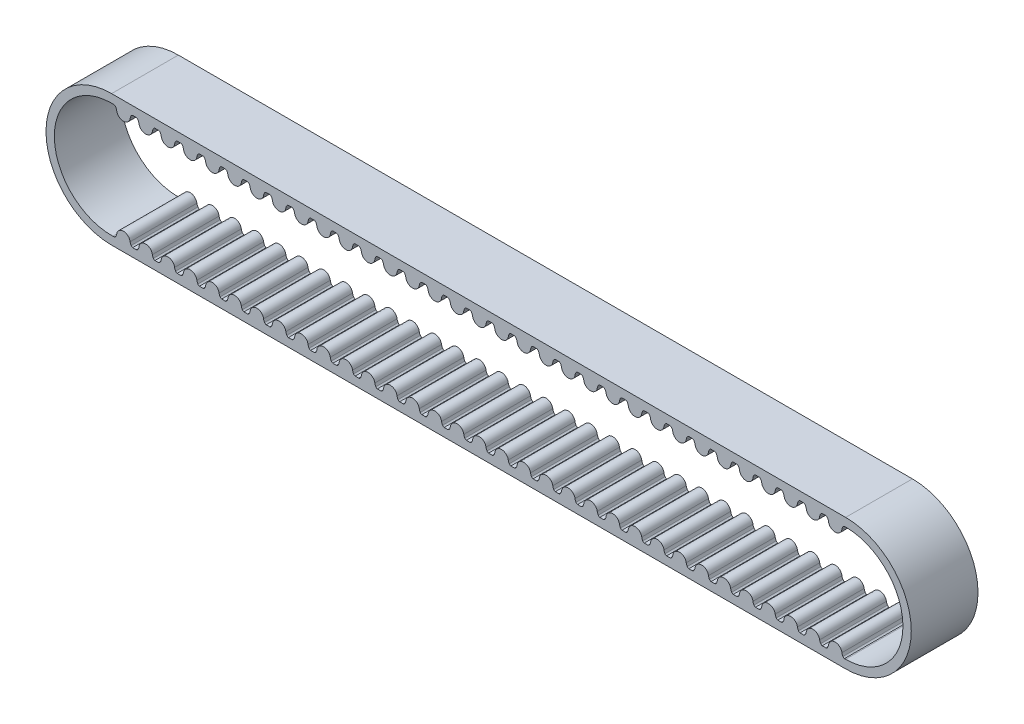
from build123d import *

# Parameters (mm, degrees)
BOSS_EXTRUDE1_DEPTH = 6


with BuildPart() as part:
    # Sketch1 → Boss-Extrude1 (new body)
    with BuildSketch(Plane.XY):
        with BuildLine():
            Line((-149.09186475, 9.090711875), (-83.09186475, 9.090711875))
            ThreePointArc((-83.09186475, 9.090711875), (-77.19186475, 3.190711875), (-83.09186475, -2.709288125))
            Line((-83.09186475, -2.709288125), (-149.09186475, -2.709288125))
            ThreePointArc((-149.09186475, -2.709288125), (-154.99186475, 3.190711875), (-149.09186475, 9.090711875))
        make_face()
        with BuildLine():
            Line((-148.86218671, -1.959304919), (-148.987691743, -1.959304919))
            ThreePointArc((-148.987691743, -1.959304919), (-154.24186475, 3.085711875), (-149.19686475, 8.340711875))
            Line((-149.19686475, 8.340711875), (-148.86218671, 8.34072867))
            ThreePointArc((-148.86218671, 8.34072867), (-148.782434101, 8.302805538), (-148.722766674, 8.237809494))
            ThreePointArc((-148.722766674, 8.237809494), (-148.665742437, 8.11963083), (-148.633605814, 7.992409772))
            ThreePointArc((-148.633605814, 7.992409772), (-148.030521792, 7.471711105), (-147.427440071, 7.992412438))
            ThreePointArc((-147.427440071, 7.992412438), (-147.395304056, 8.119633592), (-147.338280406, 8.237812478))
            ThreePointArc((-147.338280406, 8.237812478), (-147.278614273, 8.302808129), (-147.198941265, 8.340711875))
            Line((-147.198941265, 8.340711875), (-146.862186774, 8.34072867))
            ThreePointArc((-146.862186774, 8.34072867), (-146.782434165, 8.302805538), (-146.722766738, 8.237809494))
            ThreePointArc((-146.722766738, 8.237809494), (-146.665742501, 8.11963083), (-146.633605878, 7.992409772))
            ThreePointArc((-146.633605878, 7.992409772), (-146.030521856, 7.471711105), (-145.427440135, 7.992412438))
            ThreePointArc((-145.427440135, 7.992412438), (-145.395304121, 8.119633592), (-145.33828047, 8.237812478))
            ThreePointArc((-145.33828047, 8.237812478), (-145.278614337, 8.302808129), (-145.198941329, 8.340711875))
            Line((-145.198941329, 8.340711875), (-144.862186838, 8.34072867))
            ThreePointArc((-144.862186838, 8.34072867), (-144.78243423, 8.302805538), (-144.722766802, 8.237809494))
            ThreePointArc((-144.722766802, 8.237809494), (-144.665742565, 8.11963083), (-144.633605942, 7.992409772))
            ThreePointArc((-144.633605942, 7.992409772), (-144.03052192, 7.471711105), (-143.427440199, 7.992412438))
            ThreePointArc((-143.427440199, 7.992412438), (-143.395304185, 8.119633592), (-143.338280535, 8.237812478))
            ThreePointArc((-143.338280535, 8.237812478), (-143.278614401, 8.302808129), (-143.198941393, 8.340711875))
            Line((-143.198941393, 8.340711875), (-142.862186903, 8.34072867))
            ThreePointArc((-142.862186903, 8.34072867), (-142.782434294, 8.302805538), (-142.722766866, 8.237809494))
            ThreePointArc((-142.722766866, 8.237809494), (-142.665742629, 8.11963083), (-142.633606007, 7.992409772))
            ThreePointArc((-142.633606007, 7.992409772), (-142.030521984, 7.471711105), (-141.427440263, 7.992412438))
            ThreePointArc((-141.427440263, 7.992412438), (-141.395304249, 8.119633592), (-141.338280599, 8.237812478))
            ThreePointArc((-141.338280599, 8.237812478), (-141.278614465, 8.302808129), (-141.198941458, 8.340711875))
            Line((-141.198941458, 8.340711875), (-140.862186967, 8.34072867))
            ThreePointArc((-140.862186967, 8.34072867), (-140.782434358, 8.302805538), (-140.722766931, 8.237809494))
            ThreePointArc((-140.722766931, 8.237809494), (-140.665742694, 8.11963083), (-140.633606071, 7.992409772))
            ThreePointArc((-140.633606071, 7.992409772), (-140.030522048, 7.471711105), (-139.427440328, 7.992412438))
            ThreePointArc((-139.427440328, 7.992412438), (-139.395304313, 8.119633592), (-139.338280663, 8.237812478))
            ThreePointArc((-139.338280663, 8.237812478), (-139.27861453, 8.302808129), (-139.198941522, 8.340711875))
            Line((-139.198941522, 8.340711875), (-138.862187031, 8.34072867))
            ThreePointArc((-138.862187031, 8.34072867), (-138.782434422, 8.302805538), (-138.722766995, 8.237809494))
            ThreePointArc((-138.722766995, 8.237809494), (-138.665742758, 8.11963083), (-138.633606135, 7.992409772))
            ThreePointArc((-138.633606135, 7.992409772), (-138.030522113, 7.471711105), (-137.427440392, 7.992412438))
            ThreePointArc((-137.427440392, 7.992412438), (-137.395304377, 8.119633592), (-137.338280727, 8.237812478))
            ThreePointArc((-137.338280727, 8.237812478), (-137.278614594, 8.302808129), (-137.198941586, 8.340711875))
            Line((-137.198941586, 8.340711875), (-136.862187095, 8.34072867))
            ThreePointArc((-136.862187095, 8.34072867), (-136.782434486, 8.302805538), (-136.722767059, 8.237809494))
            ThreePointArc((-136.722767059, 8.237809494), (-136.665742822, 8.11963083), (-136.633606199, 7.992409772))
            ThreePointArc((-136.633606199, 7.992409772), (-136.030522177, 7.471711105), (-135.427440456, 7.992412438))
            ThreePointArc((-135.427440456, 7.992412438), (-135.395304442, 8.119633592), (-135.338280792, 8.237812478))
            ThreePointArc((-135.338280792, 8.237812478), (-135.278614658, 8.302808129), (-135.19894165, 8.340711875))
            Line((-135.19894165, 8.340711875), (-134.86218716, 8.34072867))
            ThreePointArc((-134.86218716, 8.34072867), (-134.782434551, 8.302805538), (-134.722767123, 8.237809494))
            ThreePointArc((-134.722767123, 8.237809494), (-134.665742886, 8.11963083), (-134.633606264, 7.992409772))
            ThreePointArc((-134.633606264, 7.992409772), (-134.030522241, 7.471711105), (-133.42744052, 7.992412438))
            ThreePointArc((-133.42744052, 7.992412438), (-133.395304506, 8.119633592), (-133.338280856, 8.237812478))
            ThreePointArc((-133.338280856, 8.237812478), (-133.278614722, 8.302808129), (-133.198941715, 8.340711875))
            Line((-133.198941715, 8.340711875), (-132.862187224, 8.34072867))
            ThreePointArc((-132.862187224, 8.34072867), (-132.782434615, 8.302805538), (-132.722767187, 8.237809494))
            ThreePointArc((-132.722767187, 8.237809494), (-132.665742951, 8.11963083), (-132.633606328, 7.992409772))
            ThreePointArc((-132.633606328, 7.992409772), (-132.030522305, 7.471711105), (-131.427440585, 7.992412438))
            ThreePointArc((-131.427440585, 7.992412438), (-131.39530457, 8.119633592), (-131.33828092, 8.237812478))
            ThreePointArc((-131.33828092, 8.237812478), (-131.278614786, 8.302808129), (-131.198941779, 8.340711875))
            Line((-131.198941779, 8.340711875), (-130.862187288, 8.34072867))
            ThreePointArc((-130.862187288, 8.34072867), (-130.782434679, 8.302805538), (-130.722767252, 8.237809494))
            ThreePointArc((-130.722767252, 8.237809494), (-130.665743015, 8.11963083), (-130.633606392, 7.992409772))
            ThreePointArc((-130.633606392, 7.992409772), (-130.03052237, 7.471711105), (-129.427440649, 7.992412438))
            ThreePointArc((-129.427440649, 7.992412438), (-129.395304634, 8.119633592), (-129.338280984, 8.237812478))
            ThreePointArc((-129.338280984, 8.237812478), (-129.278614851, 8.302808129), (-129.198941843, 8.340711875))
            Line((-129.198941843, 8.340711875), (-128.862187352, 8.34072867))
            ThreePointArc((-128.862187352, 8.34072867), (-128.782434743, 8.302805538), (-128.722767316, 8.237809494))
            ThreePointArc((-128.722767316, 8.237809494), (-128.665743079, 8.11963083), (-128.633606456, 7.992409772))
            ThreePointArc((-128.633606456, 7.992409772), (-128.030522434, 7.471711105), (-127.427440713, 7.992412438))
            ThreePointArc((-127.427440713, 7.992412438), (-127.395304699, 8.119633592), (-127.338281048, 8.237812478))
            ThreePointArc((-127.338281048, 8.237812478), (-127.278614915, 8.302808129), (-127.198941907, 8.340711875))
            Line((-127.198941907, 8.340711875), (-126.862187417, 8.34072867))
            ThreePointArc((-126.862187417, 8.34072867), (-126.782434808, 8.302805538), (-126.72276738, 8.237809494))
            ThreePointArc((-126.72276738, 8.237809494), (-126.665743143, 8.11963083), (-126.63360652, 7.992409772))
            ThreePointArc((-126.63360652, 7.992409772), (-126.030522498, 7.471711105), (-125.427440777, 7.992412438))
            ThreePointArc((-125.427440777, 7.992412438), (-125.395304763, 8.119633592), (-125.338281113, 8.237812478))
            ThreePointArc((-125.338281113, 8.237812478), (-125.278614979, 8.302808129), (-125.198941972, 8.340711875))
            Line((-125.198941972, 8.340711875), (-124.862187481, 8.34072867))
            ThreePointArc((-124.862187481, 8.34072867), (-124.782434872, 8.302805538), (-124.722767444, 8.237809494))
            ThreePointArc((-124.722767444, 8.237809494), (-124.665743208, 8.11963083), (-124.633606585, 7.992409772))
            ThreePointArc((-124.633606585, 7.992409772), (-124.030522562, 7.471711105), (-123.427440841, 7.992412438))
            ThreePointArc((-123.427440841, 7.992412438), (-123.395304827, 8.119633592), (-123.338281177, 8.237812478))
            ThreePointArc((-123.338281177, 8.237812478), (-123.278615043, 8.302808129), (-123.198942036, 8.340711875))
            Line((-123.198942036, 8.340711875), (-122.862187545, 8.34072867))
            ThreePointArc((-122.862187545, 8.34072867), (-122.782434936, 8.302805538), (-122.722767509, 8.237809494))
            ThreePointArc((-122.722767509, 8.237809494), (-122.665743272, 8.11963083), (-122.633606649, 7.992409772))
            ThreePointArc((-122.633606649, 7.992409772), (-122.030522627, 7.471711105), (-121.427440906, 7.992412438))
            ThreePointArc((-121.427440906, 7.992412438), (-121.395304891, 8.119633592), (-121.338281241, 8.237812478))
            ThreePointArc((-121.338281241, 8.237812478), (-121.278615108, 8.302808129), (-121.1989421, 8.340711875))
            Line((-121.1989421, 8.340711875), (-120.862187609, 8.34072867))
            ThreePointArc((-120.862187609, 8.34072867), (-120.782435, 8.302805538), (-120.722767573, 8.237809494))
            ThreePointArc((-120.722767573, 8.237809494), (-120.665743336, 8.11963083), (-120.633606713, 7.992409772))
            ThreePointArc((-120.633606713, 7.992409772), (-120.030522691, 7.471711105), (-119.42744097, 7.992412438))
            ThreePointArc((-119.42744097, 7.992412438), (-119.395304956, 8.119633592), (-119.338281305, 8.237812478))
            ThreePointArc((-119.338281305, 8.237812478), (-119.278615172, 8.302808129), (-119.198942164, 8.340711875))
            Line((-119.198942164, 8.340711875), (-118.862187673, 8.34072867))
            ThreePointArc((-118.862187673, 8.34072867), (-118.782435064, 8.302805538), (-118.722767637, 8.237809494))
            ThreePointArc((-118.722767637, 8.237809494), (-118.6657434, 8.11963083), (-118.633606777, 7.992409772))
            ThreePointArc((-118.633606777, 7.992409772), (-118.030522755, 7.471711105), (-117.427441034, 7.992412438))
            ThreePointArc((-117.427441034, 7.992412438), (-117.39530502, 8.119633592), (-117.33828137, 8.237812478))
            ThreePointArc((-117.33828137, 8.237812478), (-117.278615236, 8.302808129), (-117.198942228, 8.340711875))
            Line((-117.198942228, 8.340711875), (-116.862187738, 8.34072867))
            ThreePointArc((-116.862187738, 8.34072867), (-116.782435129, 8.302805538), (-116.722767701, 8.237809494))
            ThreePointArc((-116.722767701, 8.237809494), (-116.665743464, 8.11963083), (-116.633606842, 7.992409772))
            ThreePointArc((-116.633606842, 7.992409772), (-116.030522819, 7.471711105), (-115.427441098, 7.992412438))
            ThreePointArc((-115.427441098, 7.992412438), (-115.395305084, 8.119633592), (-115.338281434, 8.237812478))
            ThreePointArc((-115.338281434, 8.237812478), (-115.2786153, 8.302808129), (-115.198942293, 8.340711875))
            Line((-115.198942293, 8.340711875), (-114.862187802, 8.34072867))
            ThreePointArc((-114.862187802, 8.34072867), (-114.782435193, 8.302805538), (-114.722767766, 8.237809494))
            ThreePointArc((-114.722767766, 8.237809494), (-114.665743529, 8.11963083), (-114.633606906, 7.992409772))
            ThreePointArc((-114.633606906, 7.992409772), (-114.030522883, 7.471711105), (-113.427441163, 7.992412438))
            ThreePointArc((-113.427441163, 7.992412438), (-113.395305148, 8.119633592), (-113.338281498, 8.237812478))
            ThreePointArc((-113.338281498, 8.237812478), (-113.278615364, 8.302808129), (-113.198942357, 8.340711875))
            Line((-113.198942357, 8.340711875), (-112.862187866, 8.34072867))
            ThreePointArc((-112.862187866, 8.34072867), (-112.782435257, 8.302805538), (-112.72276783, 8.237809494))
            ThreePointArc((-112.72276783, 8.237809494), (-112.665743593, 8.11963083), (-112.63360697, 7.992409772))
            ThreePointArc((-112.63360697, 7.992409772), (-112.030522948, 7.471711105), (-111.427441227, 7.992412438))
            ThreePointArc((-111.427441227, 7.992412438), (-111.395305212, 8.119633592), (-111.338281562, 8.237812478))
            ThreePointArc((-111.338281562, 8.237812478), (-111.278615429, 8.302808129), (-111.198942421, 8.340711875))
            Line((-111.198942421, 8.340711875), (-110.86218793, 8.34072867))
            ThreePointArc((-110.86218793, 8.34072867), (-110.782435321, 8.302805538), (-110.722767894, 8.237809494))
            ThreePointArc((-110.722767894, 8.237809494), (-110.665743657, 8.11963083), (-110.633607034, 7.992409772))
            ThreePointArc((-110.633607034, 7.992409772), (-110.030523012, 7.471711105), (-109.427441291, 7.992412438))
            ThreePointArc((-109.427441291, 7.992412438), (-109.395305277, 8.119633592), (-109.338281627, 8.237812478))
            ThreePointArc((-109.338281627, 8.237812478), (-109.278615493, 8.302808129), (-109.198942485, 8.340711875))
            Line((-109.198942485, 8.340711875), (-108.862187995, 8.34072867))
            ThreePointArc((-108.862187995, 8.34072867), (-108.782435386, 8.302805538), (-108.722767958, 8.237809494))
            ThreePointArc((-108.722767958, 8.237809494), (-108.665743721, 8.11963083), (-108.633607098, 7.992409772))
            ThreePointArc((-108.633607098, 7.992409772), (-108.030523076, 7.471711105), (-107.427441355, 7.992412438))
            ThreePointArc((-107.427441355, 7.992412438), (-107.395305341, 8.119633592), (-107.338281691, 8.237812478))
            ThreePointArc((-107.338281691, 8.237812478), (-107.278615557, 8.302808129), (-107.19894255, 8.340711875))
            Line((-107.19894255, 8.340711875), (-106.862188059, 8.34072867))
            ThreePointArc((-106.862188059, 8.34072867), (-106.78243545, 8.302805538), (-106.722768022, 8.237809494))
            ThreePointArc((-106.722768022, 8.237809494), (-106.665743786, 8.11963083), (-106.633607163, 7.992409772))
            ThreePointArc((-106.633607163, 7.992409772), (-106.03052314, 7.471711105), (-105.42744142, 7.992412438))
            ThreePointArc((-105.42744142, 7.992412438), (-105.395305405, 8.119633592), (-105.338281755, 8.237812478))
            ThreePointArc((-105.338281755, 8.237812478), (-105.278615621, 8.302808129), (-105.198942614, 8.340711875))
            Line((-105.198942614, 8.340711875), (-104.862188123, 8.34072867))
            ThreePointArc((-104.862188123, 8.34072867), (-104.782435514, 8.302805538), (-104.722768087, 8.237809494))
            ThreePointArc((-104.722768087, 8.237809494), (-104.66574385, 8.11963083), (-104.633607227, 7.992409772))
            ThreePointArc((-104.633607227, 7.992409772), (-104.030523205, 7.471711105), (-103.427441484, 7.992412438))
            ThreePointArc((-103.427441484, 7.992412438), (-103.395305469, 8.119633592), (-103.338281819, 8.237812478))
            ThreePointArc((-103.338281819, 8.237812478), (-103.278615686, 8.302808129), (-103.198942678, 8.340711875))
            Line((-103.198942678, 8.340711875), (-102.862188187, 8.34072867))
            ThreePointArc((-102.862188187, 8.34072867), (-102.782435578, 8.302805538), (-102.722768151, 8.237809494))
            ThreePointArc((-102.722768151, 8.237809494), (-102.665743914, 8.11963083), (-102.633607291, 7.992409772))
            ThreePointArc((-102.633607291, 7.992409772), (-102.030523269, 7.471711105), (-101.427441548, 7.992412438))
            ThreePointArc((-101.427441548, 7.992412438), (-101.395305534, 8.119633592), (-101.338281883, 8.237812478))
            ThreePointArc((-101.338281883, 8.237812478), (-101.27861575, 8.302808129), (-101.198942742, 8.340711875))
            Line((-101.198942742, 8.340711875), (-100.862188251, 8.34072867))
            ThreePointArc((-100.862188251, 8.34072867), (-100.782435643, 8.302805538), (-100.722768215, 8.237809494))
            ThreePointArc((-100.722768215, 8.237809494), (-100.665743978, 8.11963083), (-100.633607355, 7.992409772))
            ThreePointArc((-100.633607355, 7.992409772), (-100.030523333, 7.471711105), (-99.427441612, 7.992412438))
            ThreePointArc((-99.427441612, 7.992412438), (-99.395305598, 8.119633592), (-99.338281948, 8.237812478))
            ThreePointArc((-99.338281948, 8.237812478), (-99.278615814, 8.302808129), (-99.198942806, 8.340711875))
            Line((-99.198942806, 8.340711875), (-98.862188316, 8.34072867))
            ThreePointArc((-98.862188316, 8.34072867), (-98.782435707, 8.302805538), (-98.722768279, 8.237809494))
            ThreePointArc((-98.722768279, 8.237809494), (-98.665744042, 8.11963083), (-98.63360742, 7.992409772))
            ThreePointArc((-98.63360742, 7.992409772), (-98.030523397, 7.471711105), (-97.427441676, 7.992412438))
            ThreePointArc((-97.427441676, 7.992412438), (-97.395305662, 8.119633592), (-97.338282012, 8.237812478))
            ThreePointArc((-97.338282012, 8.237812478), (-97.278615878, 8.302808129), (-97.198942871, 8.340711875))
            Line((-97.198942871, 8.340711875), (-96.86218838, 8.34072867))
            ThreePointArc((-96.86218838, 8.34072867), (-96.782435771, 8.302805538), (-96.722768344, 8.237809494))
            ThreePointArc((-96.722768344, 8.237809494), (-96.665744107, 8.11963083), (-96.633607484, 7.992409772))
            ThreePointArc((-96.633607484, 7.992409772), (-96.030523461, 7.471711105), (-95.427441741, 7.992412438))
            ThreePointArc((-95.427441741, 7.992412438), (-95.395305726, 8.119633592), (-95.338282076, 8.237812478))
            ThreePointArc((-95.338282076, 8.237812478), (-95.278615943, 8.302808129), (-95.198942935, 8.340711875))
            Line((-95.198942935, 8.340711875), (-94.862188444, 8.34072867))
            ThreePointArc((-94.862188444, 8.34072867), (-94.782435835, 8.302805538), (-94.722768408, 8.237809494))
            ThreePointArc((-94.722768408, 8.237809494), (-94.665744171, 8.11963083), (-94.633607548, 7.992409772))
            ThreePointArc((-94.633607548, 7.992409772), (-94.030523526, 7.471711105), (-93.427441805, 7.992412438))
            ThreePointArc((-93.427441805, 7.992412438), (-93.39530579, 8.119633592), (-93.33828214, 8.237812478))
            ThreePointArc((-93.33828214, 8.237812478), (-93.278616007, 8.302808129), (-93.198942999, 8.340711875))
            Line((-93.198942999, 8.340711875), (-92.862188508, 8.34072867))
            ThreePointArc((-92.862188508, 8.34072867), (-92.782435899, 8.302805538), (-92.722768472, 8.237809494))
            ThreePointArc((-92.722768472, 8.237809494), (-92.665744235, 8.11963083), (-92.633607612, 7.992409772))
            ThreePointArc((-92.633607612, 7.992409772), (-92.03052359, 7.471711105), (-91.427441869, 7.992412438))
            ThreePointArc((-91.427441869, 7.992412438), (-91.395305855, 8.119633592), (-91.338282205, 8.237812478))
            ThreePointArc((-91.338282205, 8.237812478), (-91.278616071, 8.302808129), (-91.198943063, 8.340711875))
            Line((-91.198943063, 8.340711875), (-90.862188573, 8.34072867))
            ThreePointArc((-90.862188573, 8.34072867), (-90.782435964, 8.302805538), (-90.722768536, 8.237809494))
            ThreePointArc((-90.722768536, 8.237809494), (-90.665744299, 8.11963083), (-90.633607677, 7.992409772))
            ThreePointArc((-90.633607677, 7.992409772), (-90.030523654, 7.471711105), (-89.427441933, 7.992412438))
            ThreePointArc((-89.427441933, 7.992412438), (-89.395305919, 8.119633592), (-89.338282269, 8.237812478))
            ThreePointArc((-89.338282269, 8.237812478), (-89.278616135, 8.302808129), (-89.198943128, 8.340711875))
            Line((-89.198943128, 8.340711875), (-88.862188637, 8.34072867))
            ThreePointArc((-88.862188637, 8.34072867), (-88.782436028, 8.302805538), (-88.7227686, 8.237809494))
            ThreePointArc((-88.7227686, 8.237809494), (-88.665744364, 8.11963083), (-88.633607741, 7.992409772))
            ThreePointArc((-88.633607741, 7.992409772), (-88.030523718, 7.471711105), (-87.427441998, 7.992412438))
            ThreePointArc((-87.427441998, 7.992412438), (-87.395305983, 8.119633592), (-87.338282333, 8.237812478))
            ThreePointArc((-87.338282333, 8.237812478), (-87.278616199, 8.302808129), (-87.198943192, 8.340711875))
            Line((-87.198943192, 8.340711875), (-86.862188701, 8.34072867))
            ThreePointArc((-86.862188701, 8.34072867), (-86.782436092, 8.302805538), (-86.722768665, 8.237809494))
            ThreePointArc((-86.722768665, 8.237809494), (-86.665744428, 8.11963083), (-86.633607805, 7.992409772))
            ThreePointArc((-86.633607805, 7.992409772), (-86.030523783, 7.471711105), (-85.427442062, 7.992412438))
            ThreePointArc((-85.427442062, 7.992412438), (-85.395306047, 8.119633592), (-85.338282397, 8.237812478))
            ThreePointArc((-85.338282397, 8.237812478), (-85.278616264, 8.302808129), (-85.198943256, 8.340711875))
            Line((-85.198943256, 8.340711875), (-84.862188765, 8.34072867))
            ThreePointArc((-84.862188765, 8.34072867), (-84.782436156, 8.302805538), (-84.722768729, 8.237809494))
            ThreePointArc((-84.722768729, 8.237809494), (-84.665744492, 8.11963083), (-84.633607869, 7.992409772))
            ThreePointArc((-84.633607869, 7.992409772), (-84.030523847, 7.471711105), (-83.427442126, 7.992412438))
            ThreePointArc((-83.427442126, 7.992412438), (-83.395306112, 8.119633592), (-83.338282461, 8.237812478))
            ThreePointArc((-83.338282461, 8.237812478), (-83.278616328, 8.302808129), (-83.19894332, 8.340711875))
            Line((-83.19894332, 8.340711875), (-83.09186475, 8.340711875))
            ThreePointArc((-83.09186475, 8.340711875), (-77.94186475, 3.190711875), (-83.09186475, -1.959288125))
            Line((-83.09186475, -1.959288125), (-83.19894332, -1.959288125))
            ThreePointArc((-83.19894332, -1.959288125), (-83.278616328, -1.921384378), (-83.338282461, -1.856388727))
            ThreePointArc((-83.338282461, -1.856388727), (-83.395306112, -1.738209842), (-83.427442126, -1.610988687))
            ThreePointArc((-83.427442126, -1.610988687), (-84.030523847, -1.090287354), (-84.633607869, -1.610986021))
            ThreePointArc((-84.633607869, -1.610986021), (-84.665744492, -1.73820708), (-84.722768729, -1.856385743))
            ThreePointArc((-84.722768729, -1.856385743), (-84.782436156, -1.921381787), (-84.862188765, -1.959304919))
            Line((-84.862188765, -1.959304919), (-85.198943256, -1.959288125))
            ThreePointArc((-85.198943256, -1.959288125), (-85.278616264, -1.921384378), (-85.338282397, -1.856388727))
            ThreePointArc((-85.338282397, -1.856388727), (-85.395306047, -1.738209842), (-85.427442062, -1.610988687))
            ThreePointArc((-85.427442062, -1.610988687), (-86.030523783, -1.090287354), (-86.633607805, -1.610986021))
            ThreePointArc((-86.633607805, -1.610986021), (-86.665744428, -1.73820708), (-86.722768665, -1.856385743))
            ThreePointArc((-86.722768665, -1.856385743), (-86.782436092, -1.921381787), (-86.862188701, -1.959304919))
            Line((-86.862188701, -1.959304919), (-87.198943192, -1.959288125))
            ThreePointArc((-87.198943192, -1.959288125), (-87.278616199, -1.921384378), (-87.338282333, -1.856388727))
            ThreePointArc((-87.338282333, -1.856388727), (-87.395305983, -1.738209842), (-87.427441998, -1.610988687))
            ThreePointArc((-87.427441998, -1.610988687), (-88.030523718, -1.090287354), (-88.633607741, -1.610986021))
            ThreePointArc((-88.633607741, -1.610986021), (-88.665744364, -1.73820708), (-88.7227686, -1.856385743))
            ThreePointArc((-88.7227686, -1.856385743), (-88.782436028, -1.921381787), (-88.862188637, -1.959304919))
            Line((-88.862188637, -1.959304919), (-89.198943128, -1.959288125))
            ThreePointArc((-89.198943128, -1.959288125), (-89.278616135, -1.921384378), (-89.338282269, -1.856388727))
            ThreePointArc((-89.338282269, -1.856388727), (-89.395305919, -1.738209842), (-89.427441933, -1.610988687))
            ThreePointArc((-89.427441933, -1.610988687), (-90.030523654, -1.090287354), (-90.633607677, -1.610986021))
            ThreePointArc((-90.633607677, -1.610986021), (-90.665744299, -1.73820708), (-90.722768536, -1.856385743))
            ThreePointArc((-90.722768536, -1.856385743), (-90.782435964, -1.921381787), (-90.862188573, -1.959304919))
            Line((-90.862188573, -1.959304919), (-91.198943063, -1.959288125))
            ThreePointArc((-91.198943063, -1.959288125), (-91.278616071, -1.921384378), (-91.338282205, -1.856388727))
            ThreePointArc((-91.338282205, -1.856388727), (-91.395305855, -1.738209842), (-91.427441869, -1.610988687))
            ThreePointArc((-91.427441869, -1.610988687), (-92.03052359, -1.090287354), (-92.633607612, -1.610986021))
            ThreePointArc((-92.633607612, -1.610986021), (-92.665744235, -1.73820708), (-92.722768472, -1.856385743))
            ThreePointArc((-92.722768472, -1.856385743), (-92.782435899, -1.921381787), (-92.862188508, -1.959304919))
            Line((-92.862188508, -1.959304919), (-93.198942999, -1.959288125))
            ThreePointArc((-93.198942999, -1.959288125), (-93.278616007, -1.921384378), (-93.33828214, -1.856388727))
            ThreePointArc((-93.33828214, -1.856388727), (-93.39530579, -1.738209842), (-93.427441805, -1.610988687))
            ThreePointArc((-93.427441805, -1.610988687), (-94.030523526, -1.090287354), (-94.633607548, -1.610986021))
            ThreePointArc((-94.633607548, -1.610986021), (-94.665744171, -1.73820708), (-94.722768408, -1.856385743))
            ThreePointArc((-94.722768408, -1.856385743), (-94.782435835, -1.921381787), (-94.862188444, -1.959304919))
            Line((-94.862188444, -1.959304919), (-95.198942935, -1.959288125))
            ThreePointArc((-95.198942935, -1.959288125), (-95.278615943, -1.921384378), (-95.338282076, -1.856388727))
            ThreePointArc((-95.338282076, -1.856388727), (-95.395305726, -1.738209842), (-95.427441741, -1.610988687))
            ThreePointArc((-95.427441741, -1.610988687), (-96.030523461, -1.090287354), (-96.633607484, -1.610986021))
            ThreePointArc((-96.633607484, -1.610986021), (-96.665744107, -1.73820708), (-96.722768344, -1.856385743))
            ThreePointArc((-96.722768344, -1.856385743), (-96.782435771, -1.921381787), (-96.86218838, -1.959304919))
            Line((-96.86218838, -1.959304919), (-97.198942871, -1.959288125))
            ThreePointArc((-97.198942871, -1.959288125), (-97.278615878, -1.921384378), (-97.338282012, -1.856388727))
            ThreePointArc((-97.338282012, -1.856388727), (-97.395305662, -1.738209842), (-97.427441676, -1.610988687))
            ThreePointArc((-97.427441676, -1.610988687), (-98.030523397, -1.090287354), (-98.63360742, -1.610986021))
            ThreePointArc((-98.63360742, -1.610986021), (-98.665744042, -1.73820708), (-98.722768279, -1.856385743))
            ThreePointArc((-98.722768279, -1.856385743), (-98.782435707, -1.921381787), (-98.862188316, -1.959304919))
            Line((-98.862188316, -1.959304919), (-99.198942806, -1.959288125))
            ThreePointArc((-99.198942806, -1.959288125), (-99.278615814, -1.921384378), (-99.338281948, -1.856388727))
            ThreePointArc((-99.338281948, -1.856388727), (-99.395305598, -1.738209842), (-99.427441612, -1.610988687))
            ThreePointArc((-99.427441612, -1.610988687), (-100.030523333, -1.090287354), (-100.633607355, -1.610986021))
            ThreePointArc((-100.633607355, -1.610986021), (-100.665743978, -1.73820708), (-100.722768215, -1.856385743))
            ThreePointArc((-100.722768215, -1.856385743), (-100.782435643, -1.921381787), (-100.862188251, -1.959304919))
            Line((-100.862188251, -1.959304919), (-101.198942742, -1.959288125))
            ThreePointArc((-101.198942742, -1.959288125), (-101.27861575, -1.921384378), (-101.338281883, -1.856388727))
            ThreePointArc((-101.338281883, -1.856388727), (-101.395305534, -1.738209842), (-101.427441548, -1.610988687))
            ThreePointArc((-101.427441548, -1.610988687), (-102.030523269, -1.090287354), (-102.633607291, -1.610986021))
            ThreePointArc((-102.633607291, -1.610986021), (-102.665743914, -1.73820708), (-102.722768151, -1.856385743))
            ThreePointArc((-102.722768151, -1.856385743), (-102.782435578, -1.921381787), (-102.862188187, -1.959304919))
            Line((-102.862188187, -1.959304919), (-103.198942678, -1.959288125))
            ThreePointArc((-103.198942678, -1.959288125), (-103.278615686, -1.921384378), (-103.338281819, -1.856388727))
            ThreePointArc((-103.338281819, -1.856388727), (-103.395305469, -1.738209842), (-103.427441484, -1.610988687))
            ThreePointArc((-103.427441484, -1.610988687), (-104.030523205, -1.090287354), (-104.633607227, -1.610986021))
            ThreePointArc((-104.633607227, -1.610986021), (-104.66574385, -1.73820708), (-104.722768087, -1.856385743))
            ThreePointArc((-104.722768087, -1.856385743), (-104.782435514, -1.921381787), (-104.862188123, -1.959304919))
            Line((-104.862188123, -1.959304919), (-105.198942614, -1.959288125))
            ThreePointArc((-105.198942614, -1.959288125), (-105.278615621, -1.921384378), (-105.338281755, -1.856388727))
            ThreePointArc((-105.338281755, -1.856388727), (-105.395305405, -1.738209842), (-105.42744142, -1.610988687))
            ThreePointArc((-105.42744142, -1.610988687), (-106.03052314, -1.090287354), (-106.633607163, -1.610986021))
            ThreePointArc((-106.633607163, -1.610986021), (-106.665743786, -1.73820708), (-106.722768022, -1.856385743))
            ThreePointArc((-106.722768022, -1.856385743), (-106.78243545, -1.921381787), (-106.862188059, -1.959304919))
            Line((-106.862188059, -1.959304919), (-107.19894255, -1.959288125))
            ThreePointArc((-107.19894255, -1.959288125), (-107.278615557, -1.921384378), (-107.338281691, -1.856388727))
            ThreePointArc((-107.338281691, -1.856388727), (-107.395305341, -1.738209842), (-107.427441355, -1.610988687))
            ThreePointArc((-107.427441355, -1.610988687), (-108.030523076, -1.090287354), (-108.633607098, -1.610986021))
            ThreePointArc((-108.633607098, -1.610986021), (-108.665743721, -1.73820708), (-108.722767958, -1.856385743))
            ThreePointArc((-108.722767958, -1.856385743), (-108.782435386, -1.921381787), (-108.862187995, -1.959304919))
            Line((-108.862187995, -1.959304919), (-109.198942485, -1.959288125))
            ThreePointArc((-109.198942485, -1.959288125), (-109.278615493, -1.921384378), (-109.338281627, -1.856388727))
            ThreePointArc((-109.338281627, -1.856388727), (-109.395305277, -1.738209842), (-109.427441291, -1.610988687))
            ThreePointArc((-109.427441291, -1.610988687), (-110.030523012, -1.090287354), (-110.633607034, -1.610986021))
            ThreePointArc((-110.633607034, -1.610986021), (-110.665743657, -1.73820708), (-110.722767894, -1.856385743))
            ThreePointArc((-110.722767894, -1.856385743), (-110.782435321, -1.921381787), (-110.86218793, -1.959304919))
            Line((-110.86218793, -1.959304919), (-111.198942421, -1.959288125))
            ThreePointArc((-111.198942421, -1.959288125), (-111.278615429, -1.921384378), (-111.338281562, -1.856388727))
            ThreePointArc((-111.338281562, -1.856388727), (-111.395305212, -1.738209842), (-111.427441227, -1.610988687))
            ThreePointArc((-111.427441227, -1.610988687), (-112.030522948, -1.090287354), (-112.63360697, -1.610986021))
            ThreePointArc((-112.63360697, -1.610986021), (-112.665743593, -1.73820708), (-112.72276783, -1.856385743))
            ThreePointArc((-112.72276783, -1.856385743), (-112.782435257, -1.921381787), (-112.862187866, -1.959304919))
            Line((-112.862187866, -1.959304919), (-113.198942357, -1.959288125))
            ThreePointArc((-113.198942357, -1.959288125), (-113.278615364, -1.921384378), (-113.338281498, -1.856388727))
            ThreePointArc((-113.338281498, -1.856388727), (-113.395305148, -1.738209842), (-113.427441163, -1.610988687))
            ThreePointArc((-113.427441163, -1.610988687), (-114.030522883, -1.090287354), (-114.633606906, -1.610986021))
            ThreePointArc((-114.633606906, -1.610986021), (-114.665743529, -1.73820708), (-114.722767766, -1.856385743))
            ThreePointArc((-114.722767766, -1.856385743), (-114.782435193, -1.921381787), (-114.862187802, -1.959304919))
            Line((-114.862187802, -1.959304919), (-115.198942293, -1.959288125))
            ThreePointArc((-115.198942293, -1.959288125), (-115.2786153, -1.921384378), (-115.338281434, -1.856388727))
            ThreePointArc((-115.338281434, -1.856388727), (-115.395305084, -1.738209842), (-115.427441098, -1.610988687))
            ThreePointArc((-115.427441098, -1.610988687), (-116.030522819, -1.090287354), (-116.633606842, -1.610986021))
            ThreePointArc((-116.633606842, -1.610986021), (-116.665743464, -1.73820708), (-116.722767701, -1.856385743))
            ThreePointArc((-116.722767701, -1.856385743), (-116.782435129, -1.921381787), (-116.862187738, -1.959304919))
            Line((-116.862187738, -1.959304919), (-117.198942228, -1.959288125))
            ThreePointArc((-117.198942228, -1.959288125), (-117.278615236, -1.921384378), (-117.33828137, -1.856388727))
            ThreePointArc((-117.33828137, -1.856388727), (-117.39530502, -1.738209842), (-117.427441034, -1.610988687))
            ThreePointArc((-117.427441034, -1.610988687), (-118.030522755, -1.090287354), (-118.633606777, -1.610986021))
            ThreePointArc((-118.633606777, -1.610986021), (-118.6657434, -1.73820708), (-118.722767637, -1.856385743))
            ThreePointArc((-118.722767637, -1.856385743), (-118.782435064, -1.921381787), (-118.862187673, -1.959304919))
            Line((-118.862187673, -1.959304919), (-119.198942164, -1.959288125))
            ThreePointArc((-119.198942164, -1.959288125), (-119.278615172, -1.921384378), (-119.338281305, -1.856388727))
            ThreePointArc((-119.338281305, -1.856388727), (-119.395304956, -1.738209842), (-119.42744097, -1.610988687))
            ThreePointArc((-119.42744097, -1.610988687), (-120.030522691, -1.090287354), (-120.633606713, -1.610986021))
            ThreePointArc((-120.633606713, -1.610986021), (-120.665743336, -1.73820708), (-120.722767573, -1.856385743))
            ThreePointArc((-120.722767573, -1.856385743), (-120.782435, -1.921381787), (-120.862187609, -1.959304919))
            Line((-120.862187609, -1.959304919), (-121.1989421, -1.959288125))
            ThreePointArc((-121.1989421, -1.959288125), (-121.278615108, -1.921384378), (-121.338281241, -1.856388727))
            ThreePointArc((-121.338281241, -1.856388727), (-121.395304891, -1.738209842), (-121.427440906, -1.610988687))
            ThreePointArc((-121.427440906, -1.610988687), (-122.030522627, -1.090287354), (-122.633606649, -1.610986021))
            ThreePointArc((-122.633606649, -1.610986021), (-122.665743272, -1.73820708), (-122.722767509, -1.856385743))
            ThreePointArc((-122.722767509, -1.856385743), (-122.782434936, -1.921381787), (-122.862187545, -1.959304919))
            Line((-122.862187545, -1.959304919), (-123.198942036, -1.959288125))
            ThreePointArc((-123.198942036, -1.959288125), (-123.278615043, -1.921384378), (-123.338281177, -1.856388727))
            ThreePointArc((-123.338281177, -1.856388727), (-123.395304827, -1.738209842), (-123.427440841, -1.610988687))
            ThreePointArc((-123.427440841, -1.610988687), (-124.030522562, -1.090287354), (-124.633606585, -1.610986021))
            ThreePointArc((-124.633606585, -1.610986021), (-124.665743208, -1.73820708), (-124.722767444, -1.856385743))
            ThreePointArc((-124.722767444, -1.856385743), (-124.782434872, -1.921381787), (-124.862187481, -1.959304919))
            Line((-124.862187481, -1.959304919), (-125.198941972, -1.959288125))
            ThreePointArc((-125.198941972, -1.959288125), (-125.278614979, -1.921384378), (-125.338281113, -1.856388727))
            ThreePointArc((-125.338281113, -1.856388727), (-125.395304763, -1.738209842), (-125.427440777, -1.610988687))
            ThreePointArc((-125.427440777, -1.610988687), (-126.030522498, -1.090287354), (-126.63360652, -1.610986021))
            ThreePointArc((-126.63360652, -1.610986021), (-126.665743143, -1.73820708), (-126.72276738, -1.856385743))
            ThreePointArc((-126.72276738, -1.856385743), (-126.782434808, -1.921381787), (-126.862187417, -1.959304919))
            Line((-126.862187417, -1.959304919), (-127.198941907, -1.959288125))
            ThreePointArc((-127.198941907, -1.959288125), (-127.278614915, -1.921384378), (-127.338281048, -1.856388727))
            ThreePointArc((-127.338281048, -1.856388727), (-127.395304699, -1.738209842), (-127.427440713, -1.610988687))
            ThreePointArc((-127.427440713, -1.610988687), (-128.030522434, -1.090287354), (-128.633606456, -1.610986021))
            ThreePointArc((-128.633606456, -1.610986021), (-128.665743079, -1.73820708), (-128.722767316, -1.856385743))
            ThreePointArc((-128.722767316, -1.856385743), (-128.782434743, -1.921381787), (-128.862187352, -1.959304919))
            Line((-128.862187352, -1.959304919), (-129.198941843, -1.959288125))
            ThreePointArc((-129.198941843, -1.959288125), (-129.278614851, -1.921384378), (-129.338280984, -1.856388727))
            ThreePointArc((-129.338280984, -1.856388727), (-129.395304634, -1.738209842), (-129.427440649, -1.610988687))
            ThreePointArc((-129.427440649, -1.610988687), (-130.03052237, -1.090287354), (-130.633606392, -1.610986021))
            ThreePointArc((-130.633606392, -1.610986021), (-130.665743015, -1.73820708), (-130.722767252, -1.856385743))
            ThreePointArc((-130.722767252, -1.856385743), (-130.782434679, -1.921381787), (-130.862187288, -1.959304919))
            Line((-130.862187288, -1.959304919), (-131.198941779, -1.959288125))
            ThreePointArc((-131.198941779, -1.959288125), (-131.278614786, -1.921384378), (-131.33828092, -1.856388727))
            ThreePointArc((-131.33828092, -1.856388727), (-131.39530457, -1.738209842), (-131.427440585, -1.610988687))
            ThreePointArc((-131.427440585, -1.610988687), (-132.030522305, -1.090287354), (-132.633606328, -1.610986021))
            ThreePointArc((-132.633606328, -1.610986021), (-132.665742951, -1.73820708), (-132.722767187, -1.856385743))
            ThreePointArc((-132.722767187, -1.856385743), (-132.782434615, -1.921381787), (-132.862187224, -1.959304919))
            Line((-132.862187224, -1.959304919), (-133.198941715, -1.959288125))
            ThreePointArc((-133.198941715, -1.959288125), (-133.278614722, -1.921384378), (-133.338280856, -1.856388727))
            ThreePointArc((-133.338280856, -1.856388727), (-133.395304506, -1.738209842), (-133.42744052, -1.610988687))
            ThreePointArc((-133.42744052, -1.610988687), (-134.030522241, -1.090287354), (-134.633606264, -1.610986021))
            ThreePointArc((-134.633606264, -1.610986021), (-134.665742886, -1.73820708), (-134.722767123, -1.856385743))
            ThreePointArc((-134.722767123, -1.856385743), (-134.782434551, -1.921381787), (-134.86218716, -1.959304919))
            Line((-134.86218716, -1.959304919), (-135.19894165, -1.959288125))
            ThreePointArc((-135.19894165, -1.959288125), (-135.278614658, -1.921384378), (-135.338280792, -1.856388727))
            ThreePointArc((-135.338280792, -1.856388727), (-135.395304442, -1.738209842), (-135.427440456, -1.610988687))
            ThreePointArc((-135.427440456, -1.610988687), (-136.030522177, -1.090287354), (-136.633606199, -1.610986021))
            ThreePointArc((-136.633606199, -1.610986021), (-136.665742822, -1.73820708), (-136.722767059, -1.856385743))
            ThreePointArc((-136.722767059, -1.856385743), (-136.782434486, -1.921381787), (-136.862187095, -1.959304919))
            Line((-136.862187095, -1.959304919), (-137.198941586, -1.959288125))
            ThreePointArc((-137.198941586, -1.959288125), (-137.278614594, -1.921384378), (-137.338280727, -1.856388727))
            ThreePointArc((-137.338280727, -1.856388727), (-137.395304377, -1.738209842), (-137.427440392, -1.610988687))
            ThreePointArc((-137.427440392, -1.610988687), (-138.030522113, -1.090287354), (-138.633606135, -1.610986021))
            ThreePointArc((-138.633606135, -1.610986021), (-138.665742758, -1.73820708), (-138.722766995, -1.856385743))
            ThreePointArc((-138.722766995, -1.856385743), (-138.782434422, -1.921381787), (-138.862187031, -1.959304919))
            Line((-138.862187031, -1.959304919), (-139.198941522, -1.959288125))
            ThreePointArc((-139.198941522, -1.959288125), (-139.27861453, -1.921384378), (-139.338280663, -1.856388727))
            ThreePointArc((-139.338280663, -1.856388727), (-139.395304313, -1.738209842), (-139.427440328, -1.610988687))
            ThreePointArc((-139.427440328, -1.610988687), (-140.030522048, -1.090287354), (-140.633606071, -1.610986021))
            ThreePointArc((-140.633606071, -1.610986021), (-140.665742694, -1.73820708), (-140.722766931, -1.856385743))
            ThreePointArc((-140.722766931, -1.856385743), (-140.782434358, -1.921381787), (-140.862186967, -1.959304919))
            Line((-140.862186967, -1.959304919), (-141.198941458, -1.959288125))
            ThreePointArc((-141.198941458, -1.959288125), (-141.278614465, -1.921384378), (-141.338280599, -1.856388727))
            ThreePointArc((-141.338280599, -1.856388727), (-141.395304249, -1.738209842), (-141.427440263, -1.610988687))
            ThreePointArc((-141.427440263, -1.610988687), (-142.030521984, -1.090287354), (-142.633606007, -1.610986021))
            ThreePointArc((-142.633606007, -1.610986021), (-142.665742629, -1.73820708), (-142.722766866, -1.856385743))
            ThreePointArc((-142.722766866, -1.856385743), (-142.782434294, -1.921381787), (-142.862186903, -1.959304919))
            Line((-142.862186903, -1.959304919), (-143.198941393, -1.959288125))
            ThreePointArc((-143.198941393, -1.959288125), (-143.278614401, -1.921384378), (-143.338280535, -1.856388727))
            ThreePointArc((-143.338280535, -1.856388727), (-143.395304185, -1.738209842), (-143.427440199, -1.610988687))
            ThreePointArc((-143.427440199, -1.610988687), (-144.03052192, -1.090287354), (-144.633605942, -1.610986021))
            ThreePointArc((-144.633605942, -1.610986021), (-144.665742565, -1.73820708), (-144.722766802, -1.856385743))
            ThreePointArc((-144.722766802, -1.856385743), (-144.78243423, -1.921381787), (-144.862186838, -1.959304919))
            Line((-144.862186838, -1.959304919), (-145.198941329, -1.959288125))
            ThreePointArc((-145.198941329, -1.959288125), (-145.278614337, -1.921384378), (-145.33828047, -1.856388727))
            ThreePointArc((-145.33828047, -1.856388727), (-145.395304121, -1.738209842), (-145.427440135, -1.610988687))
            ThreePointArc((-145.427440135, -1.610988687), (-146.030521856, -1.090287354), (-146.633605878, -1.610986021))
            ThreePointArc((-146.633605878, -1.610986021), (-146.665742501, -1.73820708), (-146.722766738, -1.856385743))
            ThreePointArc((-146.722766738, -1.856385743), (-146.782434165, -1.921381787), (-146.862186774, -1.959304919))
            Line((-146.862186774, -1.959304919), (-147.198941265, -1.959288125))
            ThreePointArc((-147.198941265, -1.959288125), (-147.278614273, -1.921384378), (-147.338280406, -1.856388727))
            ThreePointArc((-147.338280406, -1.856388727), (-147.395304056, -1.738209842), (-147.427440071, -1.610988687))
            ThreePointArc((-147.427440071, -1.610988687), (-148.030521792, -1.090287354), (-148.633605814, -1.610986021))
            ThreePointArc((-148.633605814, -1.610986021), (-148.665742437, -1.73820708), (-148.722766674, -1.856385743))
            ThreePointArc((-148.722766674, -1.856385743), (-148.782434101, -1.921381787), (-148.86218671, -1.959304919))
        make_face(mode=Mode.SUBTRACT)
    extrude(amount=BOSS_EXTRUDE1_DEPTH)


solid = part.part
